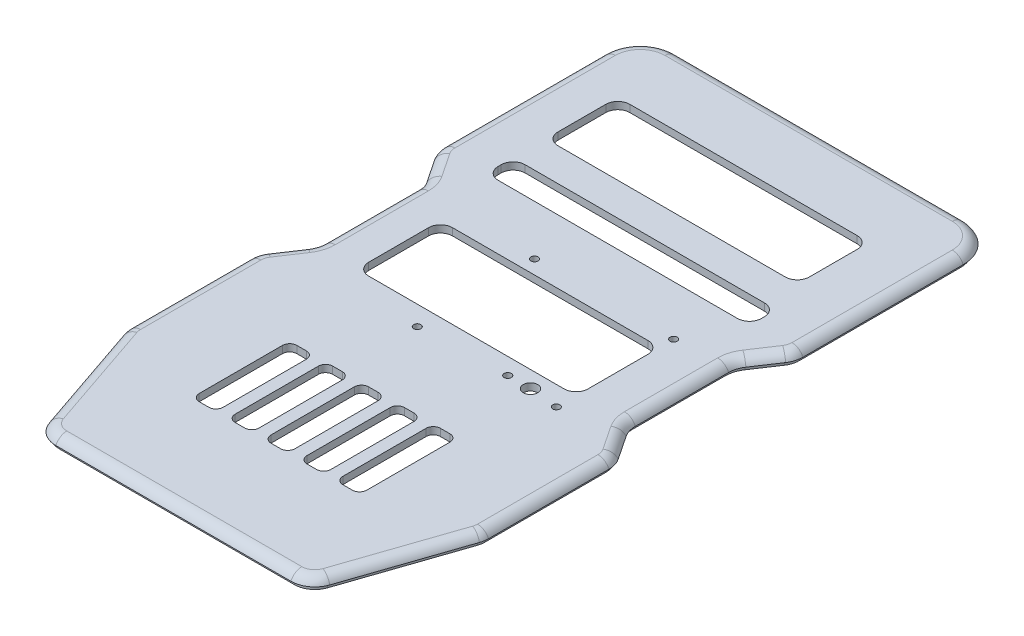
from build123d import *

# Parameters (mm, degrees)
BOSS_EXTRUDE1_DEPTH = 3
FILLET1_R           = 5
SKETCH4_R           = 1.5
CUT_EXTRUDE2_DEPTH  = 4
SKETCH5_R           = 3
SKETCH5_R_2         = 1.5
CUT_EXTRUDE3_DEPTH  = 5
CUT_EXTRUDE4_REACH  = 156.464
BOSS_EXTRUDE2_DEPTH = 2


with BuildPart() as part:
    # Sketch1 → Boss-Extrude1 (new body)
    with BuildSketch(Plane(origin=(0, 0, 0), x_dir=(1, 0, 0), z_dir=(0, 1, 0))):
        with BuildLine():
            Line((-74.465101882, -81.56903448), (-58.559066155, -128.226739278))
            ThreePointArc((-58.559066155, -128.226739278), (-54.913440505, -133.132262686), (-49.093964273, -135))
            Line((-49.093964273, -135), (49.093964273, -135))
            ThreePointArc((49.093964273, -135), (54.913440505, -133.132262686), (58.559066155, -128.226739278))
            Line((58.559066155, -128.226739278), (74.465101882, -81.56903448))
            ThreePointArc((74.465101882, -81.56903448), (74.865369198, -79.977682187), (75, -78.342295202))
            Line((75, -78.342295202), (75, -28.027756377))
            ThreePointArc((75, -28.027756377), (74.570920265, -25.12991489), (73.320502943, -22.480754415))
            Line((73.320502943, -22.480754415), (66.679497057, -12.519245585))
            ThreePointArc((66.679497057, -12.519245585), (65.429079735, -9.87008511), (65, -6.972243623))
            Line((65, -6.972243623), (65, 31.972243623))
            ThreePointArc((65, 31.972243623), (65.429079735, 34.87008511), (66.679497057, 37.519245585))
            Line((66.679497057, 37.519245585), (73.320502943, 47.480754415))
            ThreePointArc((73.320502943, 47.480754415), (74.570920265, 50.12991489), (75, 53.027756377))
            Line((75, 53.027756377), (75, 120))
            ThreePointArc((75, 120), (70.606601718, 130.606601718), (60, 135))
            Line((60, 135), (-60, 135))
            ThreePointArc((-60, 135), (-70.606601718, 130.606601718), (-75, 120))
            Line((-75, 120), (-75, 53.027756377))
            ThreePointArc((-75, 53.027756377), (-74.570920265, 50.12991489), (-73.320502943, 47.480754415))
            Line((-73.320502943, 47.480754415), (-66.679497057, 37.519245585))
            ThreePointArc((-66.679497057, 37.519245585), (-65.429079735, 34.87008511), (-65, 31.972243623))
            Line((-65, 31.972243623), (-65, -6.972243623))
            ThreePointArc((-65, -6.972243623), (-65.429079735, -9.87008511), (-66.679497057, -12.519245585))
            Line((-66.679497057, -12.519245585), (-73.320502943, -22.480754415))
            ThreePointArc((-73.320502943, -22.480754415), (-74.570920265, -25.12991489), (-75, -28.027756377))
            Line((-75, -28.027756377), (-75, -78.342295202))
            ThreePointArc((-75, -78.342295202), (-74.865369198, -79.977682187), (-74.465101882, -81.56903448))
        make_face()
    extrude(amount=BOSS_EXTRUDE1_DEPTH)

    # Fillet1
    # the kernel refuses this fillet: 5 mm, written as the material it takes off along each edge
    with BuildSketch(Plane(origin=(65, 3, 78.342295202), x_dir=(0.9465101881785362, 0, 0.3226739277881499), z_dir=(-0.3226739277881499, 0, 0.9465101881785362))) as fillet1_piece_1:
        with BuildLine():
            CenterArc((5.417424305, -5), FILLET1_R, 23.578178478, 66.421821522)
            Line((5.417424305, 0), (5.417424305, 0.1))
            Line((5.417424305, 0.1), (10, 0.1))
            Line((10, 0.1), (10.1, 0))
            ThreePointArc((10.1, 0), (10.1, -1.5), (10.091651514, -2.96))
            Line((10.091651514, -2.96), (10, -3))
        make_face()
    revolve(axis=Axis((65, 3, 78.342295202), (0, 1, 0)), revolution_arc=18.824710018, mode=Mode.SUBTRACT)
    with BuildSketch(Plane(origin=(58.559066155, 3, 128.226739278), x_dir=(0, -1, 0), z_dir=(0.322673927788139, 0, -0.9465101881785398)), Plane(origin=(-74.465101882, 3, 81.56903448), x_dir=(0, -1, 0), z_dir=(0.322673927788139, 0, 0.9465101881785398))) as fillet1_piece_2:
        with BuildLine():
            CenterArc((5, 4.582575695), FILLET1_R, 180, 66.421821522)
            Line((0, 4.582575695), (-0.1, 4.582575695))
            Line((-0.1, 4.582575695), (-0.1, 0))
            Line((-0.1, 0), (0, -0.1))
            ThreePointArc((0, -0.1), (1.5, -0.1), (2.96, -0.091651514))
            Line((2.96, -0.091651514), (3, 0))
        make_face()
    extrude(amount=49.294455972, mode=Mode.SUBTRACT)
    with BuildSketch(Plane(origin=(49.093964273, 3, 125), x_dir=(0, 0, 1), z_dir=(-1, 0, 0))) as fillet1_piece_3:
        with BuildLine():
            CenterArc((5.417424305, -5), FILLET1_R, 23.578178478, 66.421821522)
            Line((5.417424305, 0), (5.417424305, 0.1))
            Line((5.417424305, 0.1), (10, 0.1))
            Line((10, 0.1), (10.1, 0))
            ThreePointArc((10.1, 0), (10.1, -1.5), (10.091651514, -2.96))
            Line((10.091651514, -2.96), (10, -3))
        make_face()
    revolve(axis=Axis((49.093964273, 3, 125), (0, 1, 0)), revolution_arc=71.175289982, mode=Mode.SUBTRACT)
    with BuildSketch(Plane(origin=(-49.093964273, 3, 135), x_dir=(0, -1, 0), z_dir=(1, 0, 0))) as fillet1_piece_4:
        with BuildLine():
            CenterArc((5, 4.582575695), FILLET1_R, 180, 66.421821522)
            Line((0, 4.582575695), (-0.1, 4.582575695))
            Line((-0.1, 4.582575695), (-0.1, 0))
            Line((-0.1, 0), (0, -0.1))
            ThreePointArc((0, -0.1), (1.5, -0.1), (2.96, -0.091651514))
            Line((2.96, -0.091651514), (3, 0))
        make_face()
    extrude(amount=98.187928547, mode=Mode.SUBTRACT)
    with BuildSketch(Plane(origin=(-49.093964273, 3, 125), x_dir=(-0.9465101881785395, 0, 0.32267392778814025), z_dir=(-0.32267392778814025, 0, -0.9465101881785395))) as fillet1_piece_5:
        with BuildLine():
            CenterArc((5.417424305, -5), FILLET1_R, 23.578178478, 66.421821522)
            Line((5.417424305, 0), (5.417424305, 0.1))
            Line((5.417424305, 0.1), (10, 0.1))
            Line((10, 0.1), (10.1, 0))
            ThreePointArc((10.1, 0), (10.1, -1.5), (10.091651514, -2.96))
            Line((10.091651514, -2.96), (10, -3))
        make_face()
    revolve(axis=Axis((-49.093964273, 3, 125), (0, 1, 0)), revolution_arc=71.175289982, mode=Mode.SUBTRACT)
    with BuildSketch(Plane(origin=(-65, 3, 78.342295202), x_dir=(-1, 0, 0), z_dir=(0, 0, -1))) as fillet1_piece_6:
        with BuildLine():
            CenterArc((5.417424305, -5), FILLET1_R, 23.578178478, 66.421821522)
            Line((5.417424305, 0), (5.417424305, 0.1))
            Line((5.417424305, 0.1), (10, 0.1))
            Line((10, 0.1), (10.1, 0))
            ThreePointArc((10.1, 0), (10.1, -1.5), (10.091651514, -2.96))
            Line((10.091651514, -2.96), (10, -3))
        make_face()
    revolve(axis=Axis((-65, 3, 78.342295202), (0, 1, 0)), revolution_arc=18.824710018, mode=Mode.SUBTRACT)
    with BuildSketch(Plane(origin=(-75, 3, 28.027756377), x_dir=(0, -1, 0), z_dir=(0, 0, 1)), Plane(origin=(75, 3, 78.342295202), x_dir=(0, -1, 0), z_dir=(0, 0, -1))) as fillet1_piece_7:
        with BuildLine():
            CenterArc((5, 4.582575695), FILLET1_R, 180, 66.421821522)
            Line((0, 4.582575695), (-0.1, 4.582575695))
            Line((-0.1, 4.582575695), (-0.1, 0))
            Line((-0.1, 0), (0, -0.1))
            ThreePointArc((0, -0.1), (1.5, -0.1), (2.96, -0.091651514))
            Line((2.96, -0.091651514), (3, 0))
        make_face()
    extrude(amount=50.314538825, mode=Mode.SUBTRACT)
    with BuildSketch(Plane(origin=(-65, 3, 28.027756377), x_dir=(-0.8320502943378476, 0, -0.5547001962252232), z_dir=(0.5547001962252232, 0, -0.8320502943378476))) as fillet1_piece_8:
        with BuildLine():
            CenterArc((5.417424305, -5), FILLET1_R, 23.578178478, 66.421821522)
            Line((5.417424305, 0), (5.417424305, 0.1))
            Line((5.417424305, 0.1), (10, 0.1))
            Line((10, 0.1), (10.1, 0))
            ThreePointArc((10.1, 0), (10.1, -1.5), (10.091651514, -2.96))
            Line((10.091651514, -2.96), (10, -3))
        make_face()
    revolve(axis=Axis((-65, 3, 28.027756377), (0, 1, 0)), revolution_arc=33.690067526, mode=Mode.SUBTRACT)
    with BuildSketch(Plane(origin=(-66.679497057, 3, 12.519245585), x_dir=(0, -1, 0), z_dir=(-0.5547001962252323, 0, 0.8320502943378416)), Plane(origin=(-73.320502943, 3, -47.480754415), x_dir=(0, -1, 0), z_dir=(0.5547001962252289, 0, 0.8320502943378439)), Plane(origin=(66.679497057, 3, -37.519245585), x_dir=(0, -1, 0), z_dir=(0.5547001962252415, 0, -0.8320502943378355)), Plane(origin=(73.320502943, 3, 22.480754415), x_dir=(0, -1, 0), z_dir=(-0.554700196225232, 0, -0.8320502943378417))) as fillet1_piece_9:
        with BuildLine():
            CenterArc((5, 4.582575695), FILLET1_R, 180, 66.421821522)
            Line((0, 4.582575695), (-0.1, 4.582575695))
            Line((-0.1, 4.582575695), (-0.1, 0))
            Line((-0.1, 0), (0, -0.1))
            ThreePointArc((0, -0.1), (1.5, -0.1), (2.96, -0.091651514))
            Line((2.96, -0.091651514), (3, 0))
        make_face()
    extrude(amount=11.972243623, mode=Mode.SUBTRACT)
    with BuildSketch(Plane(origin=(-75, 3, 6.972243623), x_dir=(1, 0, 0), z_dir=(0, 0, -1))) as fillet1_piece_10:
        with BuildLine():
            CenterArc((14.582575695, 5), FILLET1_R, 203.578178478, 66.421821522)
            Line((14.582575695, 0), (14.582575695, -0.1))
            Line((14.582575695, -0.1), (10, -0.1))
            Line((10, -0.1), (9.9, 0))
            ThreePointArc((9.9, 0), (9.9, 1.5), (9.908348486, 2.96))
            Line((9.908348486, 2.96), (10, 3))
        make_face()
    revolve(axis=Axis((-75, 3, 6.972243623), (0, -1, 0)), revolution_arc=33.690067526, mode=Mode.SUBTRACT)
    with BuildSketch(Plane(origin=(-65, 3, -31.972243623), x_dir=(0, -1, 0), z_dir=(0, 0, 1)), Plane(origin=(65, 3, 6.972243623), x_dir=(0, -1, 0), z_dir=(0, 0, -1))) as fillet1_piece_11:
        with BuildLine():
            CenterArc((5, 4.582575695), FILLET1_R, 180, 66.421821522)
            Line((0, 4.582575695), (-0.1, 4.582575695))
            Line((-0.1, 4.582575695), (-0.1, 0))
            Line((-0.1, 0), (0, -0.1))
            ThreePointArc((0, -0.1), (1.5, -0.1), (2.96, -0.091651514))
            Line((2.96, -0.091651514), (3, 0))
        make_face()
    extrude(amount=38.944487245, mode=Mode.SUBTRACT)
    with BuildSketch(Plane(origin=(-75, 3, -31.972243623), x_dir=(0.8320502943378514, 0, -0.5547001962252177), z_dir=(-0.5547001962252177, 0, -0.8320502943378514))) as fillet1_piece_12:
        with BuildLine():
            CenterArc((14.582575695, 5), FILLET1_R, 203.578178478, 66.421821522)
            Line((14.582575695, 0), (14.582575695, -0.1))
            Line((14.582575695, -0.1), (10, -0.1))
            Line((10, -0.1), (9.9, 0))
            ThreePointArc((9.9, 0), (9.9, 1.5), (9.908348486, 2.96))
            Line((9.908348486, 2.96), (10, 3))
        make_face()
    revolve(axis=Axis((-75, 3, -31.972243623), (0, -1, 0)), revolution_arc=33.690067526, mode=Mode.SUBTRACT)
    with BuildSketch(Plane(origin=(-65, 3, -53.027756377), x_dir=(-1, 0, 0), z_dir=(0, 0, -1))) as fillet1_piece_13:
        with BuildLine():
            CenterArc((5.417424305, -5), FILLET1_R, 23.578178478, 66.421821522)
            Line((5.417424305, 0), (5.417424305, 0.1))
            Line((5.417424305, 0.1), (10, 0.1))
            Line((10, 0.1), (10.1, 0))
            ThreePointArc((10.1, 0), (10.1, -1.5), (10.091651514, -2.96))
            Line((10.091651514, -2.96), (10, -3))
        make_face()
    revolve(axis=Axis((-65, 3, -53.027756377), (0, 1, 0)), revolution_arc=33.690067526, mode=Mode.SUBTRACT)
    with BuildSketch(Plane(origin=(-75, 3, -120), x_dir=(0, -1, 0), z_dir=(0, 0, 1)), Plane(origin=(75, 3, -53.027756377), x_dir=(0, -1, 0), z_dir=(0, 0, -1))) as fillet1_piece_14:
        with BuildLine():
            CenterArc((5, 4.582575695), FILLET1_R, 180, 66.421821522)
            Line((0, 4.582575695), (-0.1, 4.582575695))
            Line((-0.1, 4.582575695), (-0.1, 0))
            Line((-0.1, 0), (0, -0.1))
            ThreePointArc((0, -0.1), (1.5, -0.1), (2.96, -0.091651514))
            Line((2.96, -0.091651514), (3, 0))
        make_face()
    extrude(amount=66.972243623, mode=Mode.SUBTRACT)
    with BuildSketch(Plane(origin=(-60, 3, -120), x_dir=(0, 0, -1), z_dir=(1, 0, 0))) as fillet1_piece_15:
        with BuildLine():
            CenterArc((10.417424305, -5), FILLET1_R, 23.578178478, 66.421821522)
            Line((10.417424305, 0), (10.417424305, 0.1))
            Line((10.417424305, 0.1), (15, 0.1))
            Line((15, 0.1), (15.1, 0))
            ThreePointArc((15.1, 0), (15.1, -1.5), (15.091651514, -2.96))
            Line((15.091651514, -2.96), (15, -3))
        make_face()
    revolve(axis=Axis((-60, 3, -120), (0, 1, 0)), revolution_arc=90, mode=Mode.SUBTRACT)
    with BuildSketch(Plane(origin=(60, 3, -135), x_dir=(0, -1, 0), z_dir=(-1, 0, 0))) as fillet1_piece_16:
        with BuildLine():
            CenterArc((5, 4.582575695), FILLET1_R, 180, 66.421821522)
            Line((0, 4.582575695), (-0.1, 4.582575695))
            Line((-0.1, 4.582575695), (-0.1, 0))
            Line((-0.1, 0), (0, -0.1))
            ThreePointArc((0, -0.1), (1.5, -0.1), (2.96, -0.091651514))
            Line((2.96, -0.091651514), (3, 0))
        make_face()
    extrude(amount=120, mode=Mode.SUBTRACT)
    with BuildSketch(Plane(origin=(60, 3, -120), x_dir=(1, 0, 0), z_dir=(0, 0, 1))) as fillet1_piece_17:
        with BuildLine():
            CenterArc((10.417424305, -5), FILLET1_R, 23.578178478, 66.421821522)
            Line((10.417424305, 0), (10.417424305, 0.1))
            Line((10.417424305, 0.1), (15, 0.1))
            Line((15, 0.1), (15.1, 0))
            ThreePointArc((15.1, 0), (15.1, -1.5), (15.091651514, -2.96))
            Line((15.091651514, -2.96), (15, -3))
        make_face()
    revolve(axis=Axis((60, 3, -120), (0, 1, 0)), revolution_arc=90, mode=Mode.SUBTRACT)
    with BuildSketch(Plane(origin=(65, 3, -53.027756377), x_dir=(0.8320502943378314, 0, 0.5547001962252475), z_dir=(-0.5547001962252475, 0, 0.8320502943378314))) as fillet1_piece_18:
        with BuildLine():
            CenterArc((5.417424305, -5), FILLET1_R, 23.578178478, 66.421821522)
            Line((5.417424305, 0), (5.417424305, 0.1))
            Line((5.417424305, 0.1), (10, 0.1))
            Line((10, 0.1), (10.1, 0))
            ThreePointArc((10.1, 0), (10.1, -1.5), (10.091651514, -2.96))
            Line((10.091651514, -2.96), (10, -3))
        make_face()
    revolve(axis=Axis((65, 3, -53.027756377), (0, 1, 0)), revolution_arc=33.690067526, mode=Mode.SUBTRACT)
    with BuildSketch(Plane(origin=(75, 3, -31.972243623), x_dir=(-1, 0, 0), z_dir=(0, 0, 1))) as fillet1_piece_19:
        with BuildLine():
            CenterArc((14.582575695, 5), FILLET1_R, 203.578178478, 66.421821522)
            Line((14.582575695, 0), (14.582575695, -0.1))
            Line((14.582575695, -0.1), (10, -0.1))
            Line((10, -0.1), (9.9, 0))
            ThreePointArc((9.9, 0), (9.9, 1.5), (9.908348486, 2.96))
            Line((9.908348486, 2.96), (10, 3))
        make_face()
    revolve(axis=Axis((75, 3, -31.972243623), (0, -1, 0)), revolution_arc=33.690067526, mode=Mode.SUBTRACT)
    with BuildSketch(Plane(origin=(75, 3, 6.972243623), x_dir=(-0.832050294337842, 0, 0.5547001962252316), z_dir=(0.5547001962252316, 0, 0.832050294337842))) as fillet1_piece_20:
        with BuildLine():
            CenterArc((14.582575695, 5), FILLET1_R, 203.578178478, 66.421821522)
            Line((14.582575695, 0), (14.582575695, -0.1))
            Line((14.582575695, -0.1), (10, -0.1))
            Line((10, -0.1), (9.9, 0))
            ThreePointArc((9.9, 0), (9.9, 1.5), (9.908348486, 2.96))
            Line((9.908348486, 2.96), (10, 3))
        make_face()
    revolve(axis=Axis((75, 3, 6.972243623), (0, -1, 0)), revolution_arc=33.690067526, mode=Mode.SUBTRACT)
    with BuildSketch(Plane(origin=(65, 3, 28.027756377), x_dir=(1, 0, 0), z_dir=(0, 0, 1))) as fillet1_piece_21:
        with BuildLine():
            CenterArc((5.417424305, -5), FILLET1_R, 23.578178478, 66.421821522)
            Line((5.417424305, 0), (5.417424305, 0.1))
            Line((5.417424305, 0.1), (10, 0.1))
            Line((10, 0.1), (10.1, 0))
            ThreePointArc((10.1, 0), (10.1, -1.5), (10.091651514, -2.96))
            Line((10.091651514, -2.96), (10, -3))
        make_face()
    revolve(axis=Axis((65, 3, 28.027756377), (0, 1, 0)), revolution_arc=33.690067526, mode=Mode.SUBTRACT)

    # Sketch4 → Cut-Extrude2 (cut)
    with BuildSketch(Plane(origin=(0, 3, 0), x_dir=(1, 0, 0), z_dir=(0, 1, 0))):
        with Locations(Location((44.462424305, 29.52955353, 0), (0, 0, 270))):
            Circle(SKETCH4_R)
        with Locations(Location((-13.627575695, 29.52955353, 0), (0, 0, 270))):
            Circle(SKETCH4_R)
        with Locations(Location((44.462424305, -19.47044647, 0), (0, 0, 270))):
            Circle(SKETCH4_R)
        with Locations(Location((-13.627575695, -19.47044647, 0), (0, 0, 270))):
            Circle(SKETCH4_R)
    extrude(amount=-CUT_EXTRUDE2_DEPTH, mode=Mode.SUBTRACT)

    # Sketch5 → Cut-Extrude3 (cut)
    with BuildSketch(Plane(origin=(0, 3, 0), x_dir=(1, 0, 0), z_dir=(0, 1, 0))):
        with Locations(Location((32.455710264, -18.250601258, 0), (0, 0, 270))):
            Circle(SKETCH5_R)
        with Locations(Location((22.930453784, -18.250601258, 0), (0, 0, 270))):
            Circle(SKETCH5_R_2)
    extrude(amount=-CUT_EXTRUDE3_DEPTH, mode=Mode.SUBTRACT)

    # Sketch8 → Cut-Extrude4 (cut, up to next)
    with BuildSketch(Plane(origin=(0, 3, 0), x_dir=(1, 0, 0), z_dir=(0, 1, 0)), mode=Mode.PRIVATE) as cut_extrude4_sk1:
        with BuildLine():
            Line((-49.700209566, 50.378911958), (50.299790434, 50.378911958))
            ThreePointArc((50.299790434, 50.378911958), (53.83532434, 51.843378052), (55.299790434, 55.378911958))
            Line((55.299790434, 55.378911958), (55.299790434, 56.654408395))
            ThreePointArc((55.299790434, 56.654408395), (53.83532434, 60.189942301), (50.299790434, 61.654408395))
            Line((50.299790434, 61.654408395), (-49.700209566, 61.654408395))
            ThreePointArc((-49.700209566, 61.654408395), (-53.235743472, 60.189942301), (-54.700209566, 56.654408395))
            Line((-54.700209566, 56.654408395), (-54.700209566, 55.378911958))
            ThreePointArc((-54.700209566, 55.378911958), (-53.235743472, 51.843378052), (-49.700209566, 50.378911958))
        make_face()
    cut_extrude4_tool1 = extrude(cut_extrude4_sk1.sketch, amount=-CUT_EXTRUDE4_REACH, mode=Mode.PRIVATE) & part.part
    # Sketch8 → Cut-Extrude4 (cut, up to next)
    with BuildSketch(Plane(origin=(0, 3, 0), x_dir=(1, 0, 0), z_dir=(0, 1, 0)), mode=Mode.PRIVATE) as cut_extrude4_sk2:
        with BuildLine():
            Line((39.563278551, 23.708557082), (0.299790434, 23.708557082))
            Line((0.299790434, 23.708557082), (-42.092636506, 23.708557082))
            ThreePointArc((-42.092636506, 23.708557082), (-45.628170412, 22.244090988), (-47.092636506, 18.708557082))
            Line((-47.092636506, 18.708557082), (-47.092636506, -6.318518591))
            ThreePointArc((-47.092636506, -6.318518591), (-45.628170412, -9.854052497), (-42.092636506, -11.318518591))
            Line((-42.092636506, -11.318518591), (39.563278551, -11.318518591))
            ThreePointArc((39.563278551, -11.318518591), (43.098812456, -9.854052497), (44.563278551, -6.318518591))
            Line((44.563278551, -6.318518591), (44.563278551, 18.708557082))
            ThreePointArc((44.563278551, 18.708557082), (43.098812456, 22.244090988), (39.563278551, 23.708557082))
        make_face()
    cut_extrude4_tool2 = extrude(cut_extrude4_sk2.sketch, amount=-CUT_EXTRUDE4_REACH, mode=Mode.PRIVATE) & part.part
    # Sketch8 → Cut-Extrude4 (cut, up to next)
    with BuildSketch(Plane(origin=(0, 3, 0), x_dir=(1, 0, 0), z_dir=(0, 1, 0)), mode=Mode.PRIVATE) as cut_extrude4_sk3:
        with BuildLine():
            ThreePointArc((-17.012604527, -51.414040717), (-19.133924871, -52.292720374), (-20.012604527, -54.414040717))
            Line((-20.012604527, -54.414040717), (-20.012604527, -89.191603926))
            ThreePointArc((-20.012604527, -89.191603926), (-19.133924871, -91.312924269), (-17.012604527, -92.191603926))
            Line((-17.012604527, -92.191603926), (-13.012604527, -92.191603926))
            ThreePointArc((-13.012604527, -92.191603926), (-10.891284184, -91.312924269), (-10.012604527, -89.191603926))
            Line((-10.012604527, -89.191603926), (-10.012604527, -54.414040717))
            ThreePointArc((-10.012604527, -54.414040717), (-10.891284184, -52.292720374), (-13.012604527, -51.414040717))
            Line((-13.012604527, -51.414040717), (-17.012604527, -51.414040717))
        make_face()
    cut_extrude4_tool3 = extrude(cut_extrude4_sk3.sketch, amount=-CUT_EXTRUDE4_REACH, mode=Mode.PRIVATE) & part.part
    # Sketch8 → Cut-Extrude4 (cut, up to next)
    with BuildSketch(Plane(origin=(0, 3, 0), x_dir=(1, 0, 0), z_dir=(0, 1, 0)), mode=Mode.PRIVATE) as cut_extrude4_sk4:
        with BuildLine():
            Line((45.299790434, 105.381575298), (-49.700209566, 105.381575298))
            ThreePointArc((-49.700209566, 105.381575298), (-53.235743472, 103.917109204), (-54.700209566, 100.381575298))
            Line((-54.700209566, 100.381575298), (-54.700209566, 80.381575298))
            ThreePointArc((-54.700209566, 80.381575298), (-53.235743472, 76.846041392), (-49.700209566, 75.381575298))
            Line((-49.700209566, 75.381575298), (45.299790434, 75.381575298))
            ThreePointArc((45.299790434, 75.381575298), (48.83532434, 76.846041392), (50.299790434, 80.381575298))
            Line((50.299790434, 80.381575298), (50.299790434, 100.381575298))
            ThreePointArc((50.299790434, 100.381575298), (48.83532434, 103.917109204), (45.299790434, 105.381575298))
        make_face()
    cut_extrude4_tool4 = extrude(cut_extrude4_sk4.sketch, amount=-CUT_EXTRUDE4_REACH, mode=Mode.PRIVATE) & part.part
    # Sketch8 → Cut-Extrude4 (cut, up to next)
    with BuildSketch(Plane(origin=(0, 3, 0), x_dir=(1, 0, 0), z_dir=(0, 1, 0)), mode=Mode.PRIVATE) as cut_extrude4_sk5:
        with BuildLine():
            Line((-28.012604527, -51.414040717), (-32.012604527, -51.414040717))
            ThreePointArc((-32.012604527, -51.414040717), (-34.133924871, -52.292720374), (-35.012604527, -54.414040717))
            Line((-35.012604527, -54.414040717), (-35.012604527, -89.191603926))
            ThreePointArc((-35.012604527, -89.191603926), (-34.133924871, -91.312924269), (-32.012604527, -92.191603926))
            Line((-32.012604527, -92.191603926), (-28.012604527, -92.191603926))
            ThreePointArc((-28.012604527, -92.191603926), (-25.891284184, -91.312924269), (-25.012604527, -89.191603926))
            Line((-25.012604527, -89.191603926), (-25.012604527, -54.414040717))
            ThreePointArc((-25.012604527, -54.414040717), (-25.891284184, -52.292720374), (-28.012604527, -51.414040717))
        make_face()
    cut_extrude4_tool5 = extrude(cut_extrude4_sk5.sketch, amount=-CUT_EXTRUDE4_REACH, mode=Mode.PRIVATE) & part.part
    # Sketch8 → Cut-Extrude4 (cut, up to next)
    with BuildSketch(Plane(origin=(0, 3, 0), x_dir=(1, 0, 0), z_dir=(0, 1, 0)), mode=Mode.PRIVATE) as cut_extrude4_sk6:
        with BuildLine():
            ThreePointArc((-2.012604527, -51.414040717), (-4.133924871, -52.292720374), (-5.012604527, -54.414040717))
            Line((-5.012604527, -54.414040717), (-5.012604527, -89.191603926))
            ThreePointArc((-5.012604527, -89.191603926), (-4.133924871, -91.312924269), (-2.012604527, -92.191603926))
            Line((-2.012604527, -92.191603926), (1.987395473, -92.191603926))
            ThreePointArc((1.987395473, -92.191603926), (4.108715816, -91.312924269), (4.987395473, -89.191603926))
            Line((4.987395473, -89.191603926), (4.987395473, -54.414040717))
            ThreePointArc((4.987395473, -54.414040717), (4.108715816, -52.292720374), (1.987395473, -51.414040717))
            Line((1.987395473, -51.414040717), (-2.012604527, -51.414040717))
        make_face()
    cut_extrude4_tool6 = extrude(cut_extrude4_sk6.sketch, amount=-CUT_EXTRUDE4_REACH, mode=Mode.PRIVATE) & part.part
    # Sketch8 → Cut-Extrude4 (cut, up to next)
    with BuildSketch(Plane(origin=(0, 3, 0), x_dir=(1, 0, 0), z_dir=(0, 1, 0)), mode=Mode.PRIVATE) as cut_extrude4_sk7:
        with BuildLine():
            ThreePointArc((12.987395473, -51.414040717), (10.866075129, -52.292720374), (9.987395473, -54.414040717))
            Line((9.987395473, -54.414040717), (9.987395473, -89.191603926))
            ThreePointArc((9.987395473, -89.191603926), (10.866075129, -91.312924269), (12.987395473, -92.191603926))
            Line((12.987395473, -92.191603926), (16.987395473, -92.191603926))
            ThreePointArc((16.987395473, -92.191603926), (19.108715816, -91.312924269), (19.987395473, -89.191603926))
            Line((19.987395473, -89.191603926), (19.987395473, -54.414040717))
            ThreePointArc((19.987395473, -54.414040717), (19.108715816, -52.292720374), (16.987395473, -51.414040717))
            Line((16.987395473, -51.414040717), (12.987395473, -51.414040717))
        make_face()
    cut_extrude4_tool7 = extrude(cut_extrude4_sk7.sketch, amount=-CUT_EXTRUDE4_REACH, mode=Mode.PRIVATE) & part.part
    # Sketch8 → Cut-Extrude4 (cut, up to next)
    with BuildSketch(Plane(origin=(0, 3, 0), x_dir=(1, 0, 0), z_dir=(0, 1, 0)), mode=Mode.PRIVATE) as cut_extrude4_sk8:
        with BuildLine():
            ThreePointArc((27.987395473, -51.414040717), (25.866075129, -52.292720374), (24.987395473, -54.414040717))
            Line((24.987395473, -54.414040717), (24.987395473, -89.191603926))
            ThreePointArc((24.987395473, -89.191603926), (25.866075129, -91.312924269), (27.987395473, -92.191603926))
            Line((27.987395473, -92.191603926), (31.987395473, -92.191603926))
            ThreePointArc((31.987395473, -92.191603926), (34.108715816, -91.312924269), (34.987395473, -89.191603926))
            Line((34.987395473, -89.191603926), (34.987395473, -54.414040717))
            ThreePointArc((34.987395473, -54.414040717), (34.108715816, -52.292720374), (31.987395473, -51.414040717))
            Line((31.987395473, -51.414040717), (27.987395473, -51.414040717))
        make_face()
    cut_extrude4_tool8 = extrude(cut_extrude4_sk8.sketch, amount=-CUT_EXTRUDE4_REACH, mode=Mode.PRIVATE) & part.part
    add(cut_extrude4_tool1.solids().sort_by_distance((0.29979, 3, -56.01666))[0], mode=Mode.SUBTRACT)
    add(cut_extrude4_tool2.solids().sort_by_distance((-1.264679, 3, -6.195019))[0], mode=Mode.SUBTRACT)
    add(cut_extrude4_tool3.solids().sort_by_distance((-15.012605, 3, 71.802822))[0], mode=Mode.SUBTRACT)
    add(cut_extrude4_tool4.solids().sort_by_distance((-2.20021, 3, -90.381575))[0], mode=Mode.SUBTRACT)
    add(cut_extrude4_tool5.solids().sort_by_distance((-30.012605, 3, 71.802822))[0], mode=Mode.SUBTRACT)
    add(cut_extrude4_tool6.solids().sort_by_distance((-0.012605, 3, 71.802822))[0], mode=Mode.SUBTRACT)
    add(cut_extrude4_tool7.solids().sort_by_distance((14.987395, 3, 71.802822))[0], mode=Mode.SUBTRACT)
    add(cut_extrude4_tool8.solids().sort_by_distance((29.987395, 3, 71.802822))[0], mode=Mode.SUBTRACT)

    # Sketch9 → Boss-Extrude2 (add)
    with BuildSketch(Plane.XZ):
        with BuildLine():
            Line((-49.093964273, 133.5), (49.093964273, 133.5))
            ThreePointArc((49.093964273, 133.5), (54.04051907, 131.912423283), (57.139300873, 127.742728386))
            Line((57.139300873, 127.742728386), (73.0453366, 81.085023588))
            ThreePointArc((73.0453366, 81.085023588), (73.385563818, 79.73237414), (73.5, 78.342295202))
            Line((73.5, 78.342295202), (73.5, 28.027756377))
            ThreePointArc((73.5, 28.027756377), (73.135282225, 25.564591113), (72.072427502, 23.312804709))
            Line((72.072427502, 23.312804709), (65.431421615, 13.351295879))
            ThreePointArc((65.431421615, 13.351295879), (63.993441695, 10.304761333), (63.5, 6.972243623))
            Line((63.5, 6.972243623), (63.5, -31.972243623))
            ThreePointArc((63.5, -31.972243623), (63.993441695, -35.304761333), (65.431421615, -38.351295879))
            Line((65.431421615, -38.351295879), (72.072427502, -48.312804709))
            ThreePointArc((72.072427502, -48.312804709), (73.135282225, -50.564591113), (73.5, -53.027756377))
            Line((73.5, -53.027756377), (73.5, -120))
            ThreePointArc((73.5, -120), (69.545941546, -129.545941546), (60, -133.5))
            Line((60, -133.5), (-60, -133.5))
            ThreePointArc((-60, -133.5), (-69.545941546, -129.545941546), (-73.5, -120))
            Line((-73.5, -120), (-73.5, -53.027756377))
            ThreePointArc((-73.5, -53.027756377), (-73.135282225, -50.564591113), (-72.072427502, -48.312804709))
            Line((-72.072427502, -48.312804709), (-65.431421615, -38.351295879))
            ThreePointArc((-65.431421615, -38.351295879), (-63.993441695, -35.304761333), (-63.5, -31.972243623))
            Line((-63.5, -31.972243623), (-63.5, 6.972243623))
            ThreePointArc((-63.5, 6.972243623), (-63.993441695, 10.304761333), (-65.431421615, 13.351295879))
            Line((-65.431421615, 13.351295879), (-72.072427502, 23.312804709))
            ThreePointArc((-72.072427502, 23.312804709), (-73.135282225, 25.564591113), (-73.5, 28.027756377))
            Line((-73.5, 28.027756377), (-73.5, 78.342295202))
            ThreePointArc((-73.5, 78.342295202), (-73.385563818, 79.73237414), (-73.0453366, 81.085023588))
            Line((-73.0453366, 81.085023588), (-57.139300873, 127.742728386))
            ThreePointArc((-57.139300873, 127.742728386), (-54.04051907, 131.912423283), (-49.093964273, 133.5))
        make_face()
        with BuildLine():
            Line((-72, 28.027756377), (-72, 78.342295202))
            ThreePointArc((-72, 78.342295202), (-71.905758438, 79.487066092), (-71.625571317, 80.601012697))
            Line((-71.625571317, 80.601012697), (-55.719535591, 127.258717495))
            ThreePointArc((-55.719535591, 127.258717495), (-53.167597636, 130.69258388), (-49.093964273, 132))
            Line((-49.093964273, 132), (49.093964273, 132))
            ThreePointArc((49.093964273, 132), (53.167597636, 130.69258388), (55.719535591, 127.258717495))
            Line((55.719535591, 127.258717495), (71.625571317, 80.601012697))
            ThreePointArc((71.625571317, 80.601012697), (71.905758438, 79.487066092), (72, 78.342295202))
            Line((72, 78.342295202), (72, 28.027756377))
            ThreePointArc((72, 28.027756377), (71.699644185, 25.999267337), (70.82435206, 24.144855004))
            Line((70.82435206, 24.144855004), (64.183346174, 14.183346174))
            ThreePointArc((64.183346174, 14.183346174), (62.557803656, 10.739437556), (62, 6.972243623))
            Line((62, 6.972243623), (62, -31.972243623))
            ThreePointArc((62, -31.972243623), (62.557803656, -35.739437556), (64.183346174, -39.183346174))
            Line((64.183346174, -39.183346174), (70.82435206, -49.144855004))
            ThreePointArc((70.82435206, -49.144855004), (71.699644185, -50.999267337), (72, -53.027756377))
            Line((72, -53.027756377), (72, -120))
            ThreePointArc((72, -120), (68.485281374, -128.485281374), (60, -132))
            Line((60, -132), (-60, -132))
            ThreePointArc((-60, -132), (-68.485281374, -128.485281374), (-72, -120))
            Line((-72, -120), (-72, -53.027756377))
            ThreePointArc((-72, -53.027756377), (-71.699644185, -50.999267337), (-70.82435206, -49.144855004))
            Line((-70.82435206, -49.144855004), (-64.183346174, -39.183346174))
            ThreePointArc((-64.183346174, -39.183346174), (-62.557803656, -35.739437556), (-62, -31.972243623))
            Line((-62, -31.972243623), (-62, 6.972243623))
            ThreePointArc((-62, 6.972243623), (-62.557803656, 10.739437556), (-64.183346174, 14.183346174))
            Line((-64.183346174, 14.183346174), (-70.82435206, 24.144855004))
            ThreePointArc((-70.82435206, 24.144855004), (-71.699644185, 25.999267337), (-72, 28.027756377))
        make_face(mode=Mode.SUBTRACT)
    extrude(amount=BOSS_EXTRUDE2_DEPTH)


solid = part.part
